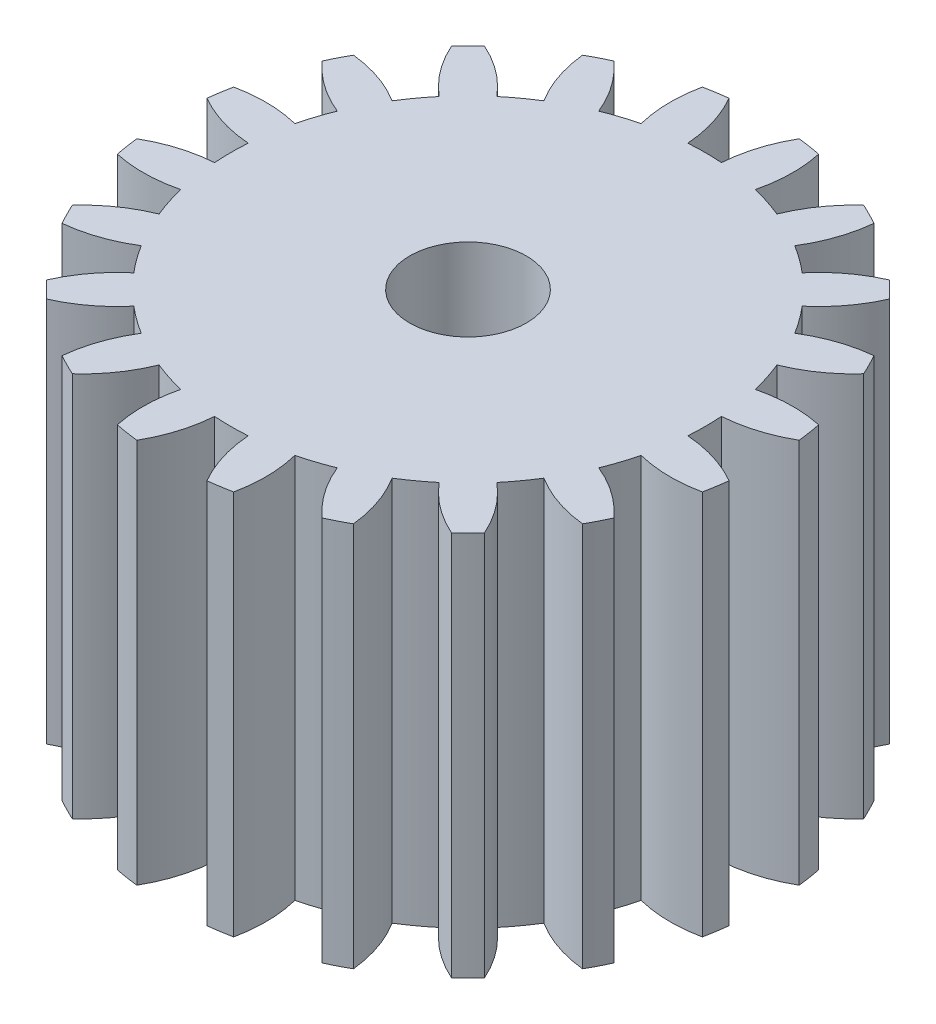
from build123d import *

# Parameters (mm, degrees)
SKETCH1_R           = 8.255
BOSS_EXTRUDE1_DEPTH = 10.668
SKETCH2_R           = 1.6129
CUT_EXTRUDE1_DEPTH  = 16.814432459
CUT_EXTRUDE6_DEPTH  = 16.814432459
CIRPATTERN1_COUNT   = 20


with BuildPart() as part:
    # Sketch1 → Boss-Extrude1 (new body)
    with BuildSketch(Plane(origin=(0, 0, 0), x_dir=(1, 0, 0), z_dir=(0, 1, 0))):
        Circle(SKETCH1_R)
    extrude(amount=BOSS_EXTRUDE1_DEPTH)

    # Sketch2 → Cut-Extrude1 (cut, through all)
    with BuildSketch(Plane(origin=(0, 10.668, 0), x_dir=(1, 0, 0), z_dir=(0, 1, 0))):
        Circle(SKETCH2_R)
    extrude(amount=-CUT_EXTRUDE1_DEPTH, mode=Mode.SUBTRACT)

    # Sketch3 → Cut-Extrude6 (cut, through all)
    with BuildSketch(Plane(origin=(0, 10.668, 0), x_dir=(1, 0, 0), z_dir=(0, 1, 0))):
        with BuildLine():
            Line((1.426333388, 8.827371755), (-1.426333388, 8.827371755))
            ThreePointArc((-1.426333388, 8.827371755), (-0.757299678, 7.767926416), (-0.465480831, 6.549373056))
            ThreePointArc((-0.465480831, 6.549373056), (0, 6.565893681), (0.465480831, 6.549373056))
            ThreePointArc((0.465480831, 6.549373056), (0.757299678, 7.767926416), (1.426333388, 8.827371755))
        make_face()
    cut_extrude6 = extrude(amount=-CUT_EXTRUDE6_DEPTH, mode=Mode.SUBTRACT)

    # CirPattern1: Cut-Extrude6 ×20 about axis
    cirpattern1_axis = Axis((0, 10.668, 0), (0, 1, 0))
    for i in range(1, CIRPATTERN1_COUNT):
        add(cut_extrude6.rotate(cirpattern1_axis, i * 360 / CIRPATTERN1_COUNT), mode=Mode.SUBTRACT)


solid = part.part
